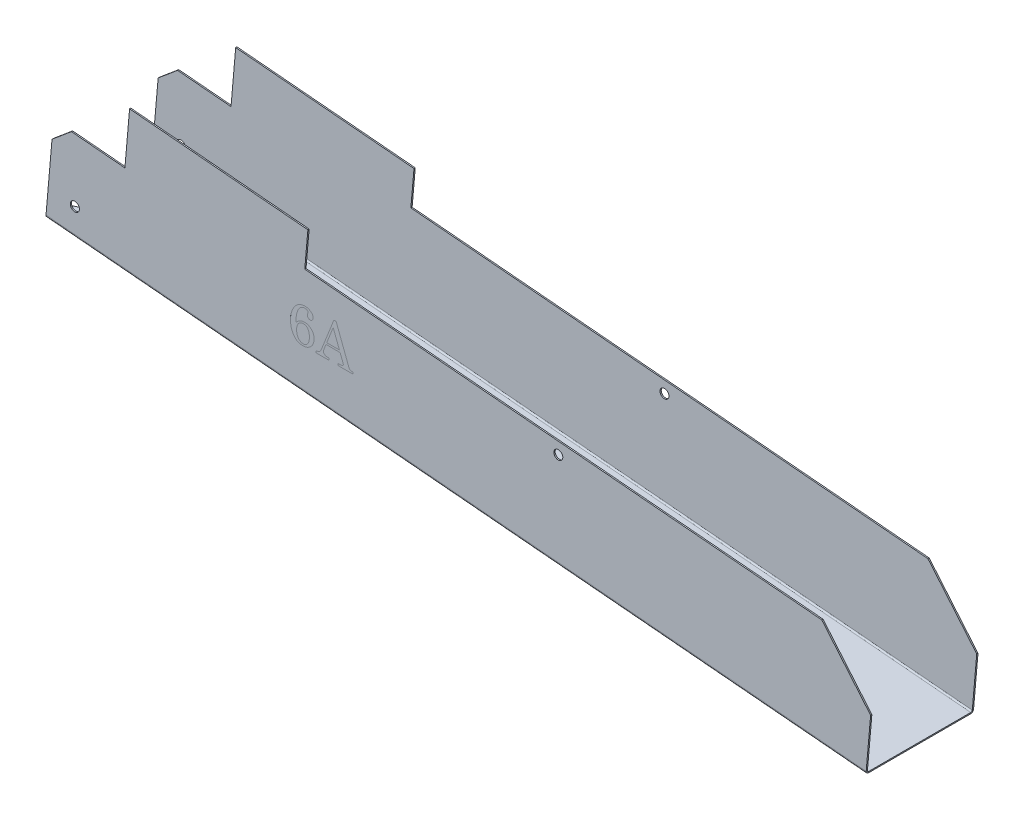
from build123d import *

# Parameters (mm, degrees)
BOSS_EXTRUDE1_DEPTH  = 38.1
CONVERT_SOLID1_START = -55.710785074
CONVERT_SOLID1_DEPTH = 584.2
CUT_EXTRUDE5_DEPTH   = 541.559685123
SKETCH7_R            = 3.2639
CUT_EXTRUDE1_DEPTH   = 542.06601882
SKETCH8_R            = 3.175
CUT_EXTRUDE2_DEPTH   = 542.06601882
CUT_EXTRUDE3_DEPTH   = 0.00254
CUT_EXTRUDE4_DEPTH   = 0.00254


# Read off the part's stored shape, not the designer's step: Convert-Solid1
with BuildPart() as part:
    # Sketch1 → Boss-Extrude1 (new, symmetric)
    with BuildSketch(Plane.XY):
        Polygon((-52.337173187, 40.992945729), (-56.764684918, -9.613744934), (525.212257707, -60.530129847), (528.532891506, -22.57511185), (493.898507307, 18.700539946), (127, 50.8), (129.213755866, 76.103345332), (2.697029208, 87.17212466), (-0.623604591, 49.217106663), (-38.578622588, 52.537740462), align=None)
    extrude(amount=BOSS_EXTRUDE1_DEPTH, both=True)

    # Convert-Solid1 outline → Convert-Solid1 (cut)
    with BuildSketch(Plane(origin=(0, 0, 0), x_dir=(0.08715574274766531, 0.9961946980917449, 0), z_dir=(0.996194698091745, -0.0871557427476653, 0)).offset(CONVERT_SOLID1_START)):
        with BuildLine():
            Line((-14.524530008, -38.1), (-12.624530008, -38.1))
            ThreePointArc((-12.624530008, -38.1), (-13.968032892, -37.543502884), (-14.524530008, -36.2))
            Line((-14.524530008, -36.2), (-14.524530008, -38.1))
        make_face()
        with BuildLine():
            Line((-14.524530008, 38.1), (-14.524530008, 36.2))
            ThreePointArc((-14.524530008, 36.2), (-13.968032892, 37.543502884), (-12.624530008, 38.1))
            Line((-12.624530008, 38.1), (-14.524530008, 38.1))
        make_face()
        with BuildLine():
            ThreePointArc((-12.624530008, 37.2), (-13.331636789, 36.907106781), (-13.624530008, 36.2))
            Line((-13.624530008, 36.2), (-13.624530008, -36.2))
            ThreePointArc((-13.624530008, -36.2), (-13.331636789, -36.907106781), (-12.624530008, -37.2))
            Line((-12.624530008, -37.2), (87.075469992, -37.2))
            Line((87.075469992, -37.2), (87.075469992, 37.2))
            Line((87.075469992, 37.2), (-12.624530008, 37.2))
        make_face()
    extrude(amount=CONVERT_SOLID1_DEPTH, mode=Mode.SUBTRACT)

    # Sketch11 → Cut-Extrude5 (cut, through all)
    with BuildSketch(Plane(origin=(-1.187456032, -13.572684558, 0), x_dir=(0.996194698091745, -0.0871557427476653, 0), z_dir=(0.0871557427476653, 0.996194698091745, 0))):
        Polygon((-55.710785074, 23.5), (-17.980790375, 0), (-55.710785074, -23.5), align=None)
    extrude(amount=-CUT_EXTRUDE5_DEPTH, mode=Mode.SUBTRACT)

    # Sketch7 → Cut-Extrude1 (cut, through all)
    with BuildSketch(Plane.XY.offset(38.1)):
        with Locations((-36.12685902, 7.703447165)):
            Circle(SKETCH7_R)
    extrude(amount=-CUT_EXTRUDE1_DEPTH, mode=Mode.SUBTRACT)

    # Sketch8 → Cut-Extrude2 (cut, through all)
    with BuildSketch(Plane.XY.offset(38.1)):
        with Locations((306.935346231, 26.643679159)):
            Circle(SKETCH8_R)
    extrude(amount=-CUT_EXTRUDE2_DEPTH, mode=Mode.SUBTRACT)

    # Sketch9 → Cut-Extrude3 (cut)
    # profile 1 of 2: a face of its own
    with BuildSketch(Plane.XY.offset(38.1)):
        with BuildLine():
            add(Edge.make_bspline(
                [(120.89433467, 15.089818668), (121.114088216, 15.345842173), (121.538987526, 15.84087041), (122.239142865, 16.478252848), (122.947738879, 17.012514754), (123.685172025, 17.424471298), (124.448056146, 17.737639932), (125.244133896, 17.954884337), (126.074937094, 18.098576279), (126.642739319, 18.111886686), (126.931063967, 18.118645585)],
                knots=[0, 0, 0, 0, 1.15518856, 2.233587714, 3.237434965, 4.189814948, 5.119660525, 6.056163246, 7.012937916, 8, 8, 8, 8], degree=3))
            add(Edge.make_bspline(
                [(126.931063967, 18.118645585), (127.163238148, 18.112284528), (127.620591221, 18.099754068), (128.29214448, 18.010660977), (128.932918228, 17.85788295), (129.545550895, 17.648311787), (130.12936233, 17.374335257), (130.684310045, 17.038368848), (131.209872932, 16.643910291), (131.699402491, 16.194529218), (132.148553243, 15.700862071), (132.540479297, 15.167432489), (132.874213134, 14.601651518), (133.146086261, 14.005552071), (133.356564242, 13.37582201), (133.508305237, 12.71563057), (133.597815675, 12.021595347), (133.610164696, 11.548600634), (133.61645395, 11.307708372)],
                knots=[0, 0, 0, 0, 1.044483906, 2.057498042, 3.041291563, 4.003930521, 4.965577941, 5.937000168, 6.91766058, 7.91718785, 8.922517361, 9.915774843, 10.889917702, 11.872928882, 12.857847881, 13.872197807, 14.916328091, 16, 16, 16, 16], degree=3))
            add(Edge.make_bspline(
                [(133.61645395, 11.307708372), (133.609686304, 11.017895276), (133.596385906, 10.448328055), (133.483616416, 9.61279963), (133.301132484, 8.813883659), (133.045838083, 8.052003737), (132.710298625, 7.331231644), (132.315625768, 6.64081832), (131.8332376, 5.995787294), (131.288239774, 5.393593114), (130.690518139, 4.847402727), (130.052725185, 4.367876698), (129.382722594, 3.955558889), (128.672045171, 3.626901354), (127.92937851, 3.36772925), (127.150897581, 3.185953045), (126.338023915, 3.073225948), (125.784071212, 3.059794099), (125.502964228, 3.052978017)],
                knots=[0, 0, 0, 0, 1.07530773, 2.113293164, 3.12278084, 4.113357206, 5.089279015, 6.06946209, 7.059700115, 8.072336363, 9.080183726, 10.060046246, 11.030156511, 11.994333323, 12.960419743, 13.944696705, 14.957022674, 16, 16, 16, 16], degree=3))
            add(Edge.make_bspline(
                [(125.502964228, 3.052978017), (125.304061517, 3.057454939), (124.908926153, 3.066348686), (124.324681697, 3.123431469), (123.756354494, 3.223199846), (123.205251831, 3.364469743), (122.672483705, 3.548125618), (122.154554857, 3.769465775), (121.655023023, 4.030885581), (121.168837033, 4.328423089), (120.708922701, 4.678109496), (120.263810831, 5.063060629), (119.840877966, 5.496050146), (119.448244789, 5.978187153), (119.066250246, 6.499042192), (118.71286809, 7.068173056), (118.38559757, 7.684367309), (118.068548348, 8.335418597), (117.790022952, 9.028342888), (117.54227243, 9.750379894), (117.338828372, 10.502308298), (117.173384272, 11.283468466), (117.035734652, 12.09094296), (116.941694516, 12.927457627), (116.89120147, 13.791866187), (116.881670292, 14.378323006), (116.876823319, 14.676559037)],
                knots=[0, 0, 0, 0, 0.883664919, 1.755467568, 2.604957291, 3.444820255, 4.280205446, 5.10616279, 5.944667041, 6.78306393, 7.635198672, 8.508239482, 9.395699299, 10.320121956, 11.268418048, 12.263647801, 13.293052967, 14.36716297, 15.479155568, 16.608498161, 17.756732724, 18.93730736, 20.154818251, 21.394408002, 22.674955442, 24, 24, 24, 24], degree=3))
            add(Edge.make_bspline(
                [(116.876823319, 14.676559037), (116.879795062, 14.999310792), (116.885682298, 15.638705063), (116.964354993, 16.58458207), (117.076561814, 17.508641461), (117.239549394, 18.409711468), (117.447659024, 19.288560268), (117.70547884, 20.14408514), (118.007541987, 20.976273219), (118.359398486, 21.779578654), (118.742311348, 22.548520564), (119.156679594, 23.273169608), (119.595775586, 23.946767655), (120.054859622, 24.575152907), (120.550070596, 25.143488446), (121.062833494, 25.672377905), (121.606648962, 26.146162918), (122.171958031, 26.573044987), (122.757389031, 26.939072232), (123.345664192, 27.267979694), (123.942631825, 27.546846434), (124.548402267, 27.771132326), (125.159184512, 27.944228183), (125.774104456, 28.072129569), (126.397429482, 28.145846084), (126.815794682, 28.156893654), (127.025224389, 28.162423964)],
                knots=[0, 0, 0, 0, 1.243152028, 2.46277293, 3.654372621, 4.828515876, 5.988718833, 7.132190138, 8.269229334, 9.397502021, 10.509151182, 11.577424797, 12.611608541, 13.605920474, 14.572893715, 15.513533556, 16.441930275, 17.348883295, 18.239769449, 19.09980024, 19.944394787, 20.775522359, 21.585751549, 22.388144142, 23.193120032, 24, 24, 24, 24], degree=3))
            add(Edge.make_bspline(
                [(127.025224389, 28.162423964), (127.238174697, 28.1591137), (127.656494255, 28.152611019), (128.27159921, 28.080233526), (128.862173988, 27.974474479), (129.427448228, 27.815460512), (129.967153936, 27.609857442), (130.484481983, 27.365642764), (130.977785124, 27.076365615), (131.281908372, 26.84888696), (131.435070833, 26.734324226)],
                knots=[0, 0, 0, 0, 1.081133678, 2.12377886, 3.141755168, 4.125997766, 5.101473931, 6.072112995, 7.02907811, 8, 8, 8, 8], degree=3))
            add(Edge.make_bspline(
                [(131.435070833, 26.734324226), (131.556118645, 26.637674953), (131.791012042, 26.450126944), (132.093665211, 26.130511832), (132.359338027, 25.806834142), (132.57721842, 25.465780445), (132.738194152, 25.104665569), (132.862683979, 24.732512785), (132.92905444, 24.342537395), (132.940903712, 24.078864435), (132.946868725, 23.946129499)],
                knots=[0, 0, 0, 0, 1.127905394, 2.18870153, 3.201176125, 4.178074235, 5.128053522, 6.076756242, 7.031824741, 8, 8, 8, 8], degree=3))
            add(Edge.make_bspline(
                [(132.946868725, 23.946129499), (132.940934165, 23.772757525), (132.929459535, 23.437538185), (132.809857183, 22.959684222), (132.622032994, 22.528966739), (132.359386265, 22.156225366), (132.041755783, 21.853445533), (131.686041661, 21.626813492), (131.291524368, 21.487637331), (131.015954788, 21.473689099), (130.875339434, 21.466571712)],
                knots=[0, 0, 0, 0, 1.153726211, 2.230760421, 3.261177434, 4.270660677, 5.249146575, 6.168386457, 7.065379467, 8, 8, 8, 8], degree=3))
            add(Edge.make_bspline(
                [(130.875339434, 21.466571712), (130.745421838, 21.473205795), (130.489441424, 21.486277121), (130.123644536, 21.602352262), (129.783907126, 21.78179695), (129.490802603, 22.041273433), (129.242868395, 22.342459386), (129.057804204, 22.680395021), (128.951365556, 23.047000786), (128.936743618, 23.300295722), (128.929357373, 23.428247176)],
                knots=[0, 0, 0, 0, 1.014689736, 1.999272662, 2.976541523, 4.002645451, 5.040935778, 6.018204639, 6.998899853, 8, 8, 8, 8], degree=3))
            add(Edge.make_bspline(
                [(128.929357373, 23.428247176), (128.937531178, 23.61911687), (128.954945449, 24.025764249), (129.051010302, 24.421448019), (129.101984814, 24.631408128)],
                knots=[0, 0, 0, 0, 0.938747937, 2, 2, 2, 2], degree=3))
            add(Edge.make_bspline(
                [(129.101984814, 24.631408128), (129.128139219, 24.728686237), (129.177312618, 24.91158068), (129.220288065, 25.173132084), (129.257050947, 25.399394124), (129.261911749, 25.539763682), (129.264149986, 25.604399158)],
                knots=[0, 0, 0, 0, 1.221676289, 2.296897074, 3.215778188, 4, 4, 4, 4], degree=3))
            add(Edge.make_bspline(
                [(129.264149986, 25.604399158), (129.260239071, 25.683868784), (129.252494311, 25.841241978), (129.155915195, 26.059883442), (129.008694851, 26.258592567), (128.874930162, 26.360854425), (128.803810143, 26.415225017)],
                knots=[0, 0, 0, 0, 0.975009045, 1.930804205, 2.899849836, 4, 4, 4, 4], degree=3))
            add(Edge.make_bspline(
                [(128.803810143, 26.415225017), (128.694040529, 26.478382471), (128.464525254, 26.610437235), (128.063622259, 26.738987531), (127.606622277, 26.808198673), (127.283547461, 26.81807512), (127.114153677, 26.823253514)],
                knots=[0, 0, 0, 0, 0.860759205, 1.799745656, 2.846368109, 4, 4, 4, 4], degree=3))
            add(Edge.make_bspline(
                [(127.114153677, 26.823253514), (126.842478379, 26.812682502), (126.305474194, 26.791787421), (125.52393702, 26.578232915), (124.775576183, 26.253866271), (124.195066778, 25.866797314), (123.750323222, 25.495986708), (123.429501375, 25.161431408), (123.123489829, 24.780346822), (122.829315951, 24.35297439), (122.547689992, 23.88055804), (122.273808486, 23.361640789), (122.021011662, 22.792264893), (121.697322407, 21.96867417), (121.348902277, 20.869822693), (121.054298255, 19.475479799), (120.871628266, 18.001446734), (120.852051293, 16.9927546), (120.842023324, 16.47606933)],
                knots=[0, 0, 0, 0, 0.971688549, 1.920678183, 2.88340009, 3.885392209, 4.408774106, 4.956875509, 5.543534456, 6.159017994, 6.815026857, 7.513966368, 8.260917618, 9.046686804, 10.685410247, 12.385720898, 14.148647427, 16, 16, 16, 16], degree=3))
            add(Edge.make_bspline(
                [(120.842023324, 16.47606933), (120.843519451, 16.388877473), (120.846811567, 16.197018209), (120.858210949, 15.879669817), (120.873722498, 15.50475786), (120.887145755, 15.234537162), (120.89433467, 15.089818668)],
                knots=[0, 0, 0, 0, 0.754292582, 1.659765325, 2.74667174, 4, 4, 4, 4], degree=3))
        make_face()
        with BuildLine():
            add(Edge.make_bspline(
                [(126.026077686, 16.779475135), (125.854902559, 16.774308519), (125.517943655, 16.764138016), (125.023958287, 16.687928154), (124.551939118, 16.571718788), (124.10565542, 16.39362446), (123.683148695, 16.171247458), (123.287322107, 15.893874221), (122.912819959, 15.572690993), (122.565004715, 15.203346794), (122.248748804, 14.789144223), (121.979085552, 14.330231455), (121.739319201, 13.837515065), (121.553371588, 13.299321711), (121.407532431, 12.723409035), (121.303834923, 12.107643488), (121.240246332, 11.452037247), (121.232904463, 11.000965095), (121.229127283, 10.768901511)],
                knots=[0, 0, 0, 0, 0.949075543, 1.868258902, 2.766701683, 3.639584075, 4.526552555, 5.40923933, 6.314579547, 7.258763553, 8.218230028, 9.198529645, 10.206493817, 11.252665883, 12.350497027, 13.498519192, 14.713060431, 16, 16, 16, 16], degree=3))
            add(Edge.make_bspline(
                [(121.229127283, 10.768901511), (121.232749537, 10.517649445), (121.239779729, 10.030011014), (121.30516682, 9.322720062), (121.401798309, 8.65971962), (121.542090852, 8.041833853), (121.724073329, 7.46865906), (121.949920046, 6.943837268), (122.212280471, 6.462369512), (122.514301665, 6.029169454), (122.851721578, 5.645596454), (123.211928673, 5.309606024), (123.595871941, 5.0245511), (124.001398316, 4.792589912), (124.429621987, 4.611551014), (124.882162154, 4.4890596), (125.355218696, 4.406111839), (125.678716257, 4.396851074), (125.842987976, 4.392148468)],
                knots=[0, 0, 0, 0, 1.364103527, 2.647497837, 3.854117083, 5.000370457, 6.084428247, 7.115189779, 8.098401111, 9.057233799, 9.976535432, 10.867705672, 11.727535847, 12.567318146, 13.399161598, 14.244637041, 15.108628548, 16, 16, 16, 16], degree=3))
            add(Edge.make_bspline(
                [(125.842987976, 4.392148468), (126.00544655, 4.397281487), (126.323338108, 4.407325545), (126.788167355, 4.483037976), (127.228797586, 4.60256894), (127.646930508, 4.769611707), (128.036143754, 4.993838658), (128.404089562, 5.260661072), (128.745622388, 5.57744355), (129.061438817, 5.941976285), (129.349842295, 6.353393312), (129.594855368, 6.818786296), (129.803798756, 7.328787751), (129.977021702, 7.885022026), (130.105756984, 8.49123243), (130.197838849, 9.143227635), (130.256553463, 9.843677169), (130.264445025, 10.325877272), (130.268527824, 10.575349532)],
                knots=[0, 0, 0, 0, 0.909396033, 1.779464838, 2.629860702, 3.462124791, 4.29295567, 5.138629575, 6.002374521, 6.895212095, 7.835129073, 8.809266767, 9.833779316, 10.917798107, 12.066925648, 13.300059089, 14.603151772, 16, 16, 16, 16], degree=3))
            add(Edge.make_bspline(
                [(130.268527824, 10.575349532), (130.266169319, 10.83874703), (130.261618983, 11.346928015), (130.208509273, 12.082189126), (130.122185612, 12.762214572), (129.997104982, 13.384344116), (129.841473688, 13.950482474), (129.6480721, 14.46066289), (129.420861428, 14.916567413), (129.154404219, 15.314890708), (128.860622905, 15.663644687), (128.534544894, 15.963092807), (128.182647247, 16.215046988), (127.803990565, 16.423842221), (127.397611977, 16.584022361), (126.964235824, 16.699784395), (126.504393924, 16.769561835), (126.188494273, 16.776108985), (126.026077686, 16.779475135)],
                knots=[0, 0, 0, 0, 1.481997958, 2.859264748, 4.145766163, 5.336979382, 6.427417082, 7.446135251, 8.402802757, 9.287300334, 10.136644771, 10.963063103, 11.771815852, 12.566698608, 13.39031591, 14.223406735, 15.086582672, 16, 16, 16, 16], degree=3))
        make_face(mode=Mode.SUBTRACT)
    # profile 2 of 2: a face of its own
    with BuildSketch(Plane.XY.offset(38.1)):
        with BuildLine():
            Line((147.667281411, 29.836387027), (149.252315186, 29.836387027))
            Line((149.252315186, 29.836387027), (158.281253458, 6.191658761))
            add(Edge.make_bspline(
                [(158.281253458, 6.191658761), (158.331763824, 6.074710298), (158.428767939, 5.850113185), (158.629710333, 5.549230252), (158.862347869, 5.289883042), (159.141675612, 5.086518511), (159.448382854, 4.916329442), (159.80059728, 4.8143571), (160.183515277, 4.734026653), (160.453420453, 4.729361041), (160.593414939, 4.72694108)],
                knots=[0, 0, 0, 0, 1.039787226, 1.996889935, 2.945563617, 3.872445737, 4.810232727, 5.797866669, 6.857796924, 8, 8, 8, 8], degree=3))
            Line((160.593414939, 4.72694108), (161.404240798, 4.72694108))
            Line((161.404240798, 4.72694108), (161.404240798, 3.38777063))
            Line((161.404240798, 3.38777063), (150.690877194, 3.38777063))
            Line((150.690877194, 3.38777063), (150.690877194, 4.72694108))
            Line((150.690877194, 4.72694108), (151.543552129, 4.72694108))
            add(Edge.make_bspline(
                [(151.543552129, 4.72694108), (151.801931058, 4.729449204), (152.279632334, 4.734086322), (152.932993426, 4.803538), (153.472887149, 4.898148272), (153.773491061, 5.025612295), (153.908024956, 5.082658231)],
                knots=[0, 0, 0, 0, 1.28614417, 2.377874675, 3.274025287, 4, 4, 4, 4], degree=3))
            add(Edge.make_bspline(
                [(153.908024956, 5.082658231), (153.978625849, 5.126311345), (154.115739961, 5.211090129), (154.27386224, 5.392429707), (154.360013044, 5.614663137), (154.372403013, 5.770720891), (154.378827067, 5.851635013)],
                knots=[0, 0, 0, 0, 1.044845995, 2.029197152, 2.978161746, 4, 4, 4, 4], degree=3))
            add(Edge.make_bspline(
                [(154.378827067, 5.851635013), (154.373122039, 5.957203687), (154.361191286, 6.177976232), (154.286844472, 6.386337281), (154.248048703, 6.495064566)],
                knots=[0, 0, 0, 0, 0.9563569, 2, 2, 2, 2], degree=3))
            Line((154.248048703, 6.495064566), (152.108514663, 12.092378558))
            Line((152.108514663, 12.092378558), (142.080429688, 12.092378558))
            Line((142.080429688, 12.092378558), (140.814495121, 8.880461931))
            add(Edge.make_bspline(
                [(140.814495121, 8.880461931), (140.743916929, 8.678988642), (140.611781776, 8.301794174), (140.464251816, 7.760425611), (140.367329394, 7.284876553), (140.351118004, 6.987145699), (140.34369301, 6.850781717)],
                knots=[0, 0, 0, 0, 1.224040328, 2.291625076, 3.217545626, 4, 4, 4, 4], degree=3))
            add(Edge.make_bspline(
                [(140.34369301, 6.850781717), (140.354056748, 6.708230254), (140.374467429, 6.427484811), (140.530897566, 6.023157524), (140.791170979, 5.660290872), (141.138973477, 5.325895431), (141.589660711, 5.05327409), (142.13479711, 4.864434332), (142.76546428, 4.741116618), (143.216667112, 4.731857107), (143.45621808, 4.72694108)],
                knots=[0, 0, 0, 0, 0.81354721, 1.602226087, 2.440081589, 3.349586742, 4.342853265, 5.424428202, 6.632586778, 8, 8, 8, 8], degree=3))
            Line((143.45621808, 4.72694108), (144.329817554, 4.72694108))
            Line((144.329817554, 4.72694108), (144.329817554, 3.38777063))
            Line((144.329817554, 3.38777063), (134.9556244, 3.38777063))
            Line((134.9556244, 3.38777063), (134.9556244, 4.72694108))
            add(Edge.make_bspline(
                [(134.9556244, 4.72694108), (135.198613629, 4.734080283), (135.662028285, 4.747695748), (136.318459585, 4.874072376), (136.897708662, 5.080370234), (137.409285025, 5.385972702), (137.866980605, 5.81655579), (138.276144723, 6.394067359), (138.684889284, 7.106684976), (138.909831112, 7.648028061), (139.030678232, 7.938857708)],
                knots=[0, 0, 0, 0, 1.036060294, 1.975912788, 2.839911673, 3.647735987, 4.500737518, 5.500873586, 6.657376306, 8, 8, 8, 8], degree=3))
            Line((139.030678232, 7.938857708), (147.667281411, 29.836387027))
        make_face()
        Polygon((147.175554761, 25.013280952), (142.60877428, 13.431549009), (151.595863475, 13.431549009), align=None, mode=Mode.SUBTRACT)
    extrude(amount=-CUT_EXTRUDE3_DEPTH, mode=Mode.SUBTRACT)

    # Sketch10 → Cut-Extrude4 (cut)
    # profile 1 of 2: a face of its own
    with BuildSketch(Plane(origin=(0, 0, -38.1), x_dir=(-1, 0, 0), z_dir=(0, 0, -1))):
        with BuildLine():
            add(Edge.make_bspline(
                [(-155.278783024, 13.635392643), (-155.059029478, 13.891416148), (-154.634130169, 14.386444385), (-153.93397483, 15.023826823), (-153.225378815, 15.558088729), (-152.48794567, 15.970045273), (-151.725061548, 16.283213907), (-150.928983798, 16.500458312), (-150.098180601, 16.644150254), (-149.530378376, 16.65746066), (-149.242053728, 16.66421956)],
                knots=[0, 0, 0, 0, 1.15518856, 2.233587714, 3.237434965, 4.189814948, 5.119660525, 6.056163246, 7.012937916, 8, 8, 8, 8], degree=3))
            add(Edge.make_bspline(
                [(-149.242053728, 16.66421956), (-149.009879546, 16.657858503), (-148.552526473, 16.645328043), (-147.880973214, 16.556234952), (-147.240199466, 16.403456924), (-146.6275668, 16.193885761), (-146.043755365, 15.919909232), (-145.488807649, 15.583942823), (-144.963244762, 15.189484266), (-144.473715204, 14.740103193), (-144.024564452, 14.246436046), (-143.632638397, 13.713006464), (-143.298904561, 13.147225493), (-143.027031434, 12.551126046), (-142.816553452, 11.921395985), (-142.664812457, 11.261204545), (-142.57530202, 10.567169322), (-142.562952998, 10.094174609), (-142.556663745, 9.853282347)],
                knots=[0, 0, 0, 0, 1.044483906, 2.057498042, 3.041291563, 4.003930521, 4.965577941, 5.937000168, 6.91766058, 7.91718785, 8.922517361, 9.915774843, 10.889917702, 11.872928882, 12.857847881, 13.872197807, 14.916328091, 16, 16, 16, 16], degree=3))
            add(Edge.make_bspline(
                [(-142.556663745, 9.853282347), (-142.563431391, 9.56346925), (-142.576731788, 8.993902029), (-142.689501278, 8.158373604), (-142.871985211, 7.359457634), (-143.127279612, 6.597577711), (-143.462819069, 5.876805619), (-143.857491927, 5.186392295), (-144.339880094, 4.541361269), (-144.88487792, 3.939167089), (-145.482599555, 3.392976702), (-146.120392509, 2.913450672), (-146.7903951, 2.501132864), (-147.501072524, 2.172475329), (-148.243739185, 1.913303225), (-149.022220113, 1.73152702), (-149.83509378, 1.618799923), (-150.389046483, 1.605368073), (-150.670153466, 1.598551992)],
                knots=[0, 0, 0, 0, 1.07530773, 2.113293164, 3.12278084, 4.113357206, 5.089279015, 6.06946209, 7.059700115, 8.072336363, 9.080183726, 10.060046246, 11.030156511, 11.994333323, 12.960419743, 13.944696705, 14.957022674, 16, 16, 16, 16], degree=3))
            add(Edge.make_bspline(
                [(-150.670153466, 1.598551992), (-150.869056178, 1.603028914), (-151.264191542, 1.611922661), (-151.848435998, 1.669005444), (-152.4167632, 1.768773821), (-152.967865863, 1.910043718), (-153.500633989, 2.093699592), (-154.018562837, 2.31503975), (-154.518094671, 2.576459556), (-155.004280661, 2.873997064), (-155.464194993, 3.22368347), (-155.909306863, 3.608634603), (-156.332239729, 4.04162412), (-156.724872905, 4.523761127), (-157.106867449, 5.044616167), (-157.460249604, 5.61374703), (-157.787520124, 6.229941283), (-158.104569346, 6.880992571), (-158.383094742, 7.573916863), (-158.630845265, 8.295953868), (-158.834289322, 9.047882273), (-158.999733422, 9.82904244), (-159.137383043, 10.636516935), (-159.231423178, 11.473031601), (-159.281916224, 12.337440161), (-159.291447402, 12.92389698), (-159.296294376, 13.222133011)],
                knots=[0, 0, 0, 0, 0.883664919, 1.755467568, 2.604957291, 3.444820255, 4.280205446, 5.10616279, 5.944667041, 6.78306393, 7.635198672, 8.508239482, 9.395699299, 10.320121956, 11.268418048, 12.263647801, 13.293052967, 14.36716297, 15.479155568, 16.608498161, 17.756732724, 18.93730736, 20.154818251, 21.394408002, 22.674955442, 24, 24, 24, 24], degree=3))
            add(Edge.make_bspline(
                [(-159.296294376, 13.222133011), (-159.293322632, 13.544884766), (-159.287435396, 14.184279038), (-159.208762701, 15.130156045), (-159.09655588, 16.054215436), (-158.9335683, 16.955285443), (-158.72545867, 17.834134243), (-158.467638855, 18.689659115), (-158.165575708, 19.521847194), (-157.813719208, 20.325152629), (-157.430806346, 21.094094538), (-157.0164381, 21.818743583), (-156.577342109, 22.492341629), (-156.118258073, 23.120726881), (-155.623047099, 23.689062421), (-155.1102842, 24.21795188), (-154.566468733, 24.691736893), (-154.001159663, 25.118618962), (-153.415728663, 25.484646207), (-152.827453502, 25.813553669), (-152.230485869, 26.092420408), (-151.624715428, 26.316706301), (-151.013933183, 26.489802158), (-150.399013239, 26.617703544), (-149.775688212, 26.691420059), (-149.357323012, 26.702467629), (-149.147893306, 26.707997939)],
                knots=[0, 0, 0, 0, 1.243152028, 2.46277293, 3.654372621, 4.828515876, 5.988718833, 7.132190138, 8.269229334, 9.397502021, 10.509151182, 11.577424797, 12.611608541, 13.605920474, 14.572893715, 15.513533556, 16.441930275, 17.348883295, 18.239769449, 19.09980024, 19.944394787, 20.775522359, 21.585751549, 22.388144142, 23.193120032, 24, 24, 24, 24], degree=3))
            add(Edge.make_bspline(
                [(-149.147893306, 26.707997939), (-148.934942998, 26.704687675), (-148.51662344, 26.698184993), (-147.901518484, 26.6258075), (-147.310943706, 26.520048454), (-146.745669466, 26.361034486), (-146.205963759, 26.155431417), (-145.688635712, 25.911216738), (-145.19533257, 25.62193959), (-144.891209322, 25.394460935), (-144.738046861, 25.279898201)],
                knots=[0, 0, 0, 0, 1.081133678, 2.12377886, 3.141755168, 4.125997766, 5.101473931, 6.072112995, 7.02907811, 8, 8, 8, 8], degree=3))
            add(Edge.make_bspline(
                [(-144.738046861, 25.279898201), (-144.61699905, 25.183248928), (-144.382105652, 24.995700919), (-144.079452483, 24.676085806), (-143.813779668, 24.352408117), (-143.595899275, 24.01135442), (-143.434923543, 23.650239543), (-143.310433715, 23.27808676), (-143.244063255, 22.88811137), (-143.232213982, 22.624438409), (-143.22624897, 22.491703474)],
                knots=[0, 0, 0, 0, 1.127905394, 2.18870153, 3.201176125, 4.178074235, 5.128053522, 6.076756242, 7.031824741, 8, 8, 8, 8], degree=3))
            add(Edge.make_bspline(
                [(-143.22624897, 22.491703474), (-143.23218353, 22.318331499), (-143.24365816, 21.98311216), (-143.363260511, 21.505258197), (-143.551084701, 21.074540714), (-143.813731429, 20.701799341), (-144.131361911, 20.399019507), (-144.487076034, 20.172387466), (-144.881593327, 20.033211306), (-145.157162906, 20.019263074), (-145.29777826, 20.012145686)],
                knots=[0, 0, 0, 0, 1.153726211, 2.230760421, 3.261177434, 4.270660677, 5.249146575, 6.168386457, 7.065379467, 8, 8, 8, 8], degree=3))
            add(Edge.make_bspline(
                [(-145.29777826, 20.012145686), (-145.427695857, 20.018779769), (-145.683676271, 20.031851096), (-146.049473158, 20.147926237), (-146.389210569, 20.327370925), (-146.682315092, 20.586847408), (-146.930249299, 20.88803336), (-147.11531349, 21.225968995), (-147.221752138, 21.592574761), (-147.236374077, 21.845869697), (-147.243760321, 21.973821151)],
                knots=[0, 0, 0, 0, 1.014689736, 1.999272662, 2.976541523, 4.002645451, 5.040935778, 6.018204639, 6.998899853, 8, 8, 8, 8], degree=3))
            add(Edge.make_bspline(
                [(-147.243760321, 21.973821151), (-147.235586516, 22.164690845), (-147.218172246, 22.571338224), (-147.122107392, 22.967021994), (-147.07113288, 23.176982103)],
                knots=[0, 0, 0, 0, 0.938747937, 2, 2, 2, 2], degree=3))
            add(Edge.make_bspline(
                [(-147.07113288, 23.176982103), (-147.044978476, 23.274260212), (-146.995805077, 23.457154654), (-146.95282963, 23.718706059), (-146.916066747, 23.944968099), (-146.911205945, 24.085337657), (-146.908967709, 24.149973133)],
                knots=[0, 0, 0, 0, 1.221676289, 2.296897074, 3.215778188, 4, 4, 4, 4], degree=3))
            add(Edge.make_bspline(
                [(-146.908967709, 24.149973133), (-146.912878624, 24.229442759), (-146.920623384, 24.386815952), (-147.017202499, 24.605457417), (-147.164422843, 24.804166542), (-147.298187532, 24.9064284), (-147.369307551, 24.960798992)],
                knots=[0, 0, 0, 0, 0.975009045, 1.930804205, 2.899849836, 4, 4, 4, 4], degree=3))
            add(Edge.make_bspline(
                [(-147.369307551, 24.960798992), (-147.479077165, 25.023956446), (-147.708592441, 25.15601121), (-148.109495435, 25.284561505), (-148.566495418, 25.353772648), (-148.889570233, 25.363649094), (-149.058964018, 25.368827488)],
                knots=[0, 0, 0, 0, 0.860759205, 1.799745656, 2.846368109, 4, 4, 4, 4], degree=3))
            add(Edge.make_bspline(
                [(-149.058964018, 25.368827488), (-149.330639315, 25.358256477), (-149.8676435, 25.337361396), (-150.649180674, 25.12380689), (-151.397541511, 24.799440246), (-151.978050917, 24.412371289), (-152.422794473, 24.041560683), (-152.743616319, 23.707005383), (-153.049627865, 23.325920796), (-153.343801743, 22.898548364), (-153.625427702, 22.426132014), (-153.899309208, 21.907214764), (-154.152106032, 21.337838867), (-154.475795287, 20.514248145), (-154.824215417, 19.415396667), (-155.11881944, 18.021053774), (-155.301489429, 16.547020709), (-155.321066401, 15.538328575), (-155.33109437, 15.021643304)],
                knots=[0, 0, 0, 0, 0.971688549, 1.920678183, 2.88340009, 3.885392209, 4.408774106, 4.956875509, 5.543534456, 6.159017994, 6.815026857, 7.513966368, 8.260917618, 9.046686804, 10.685410247, 12.385720898, 14.148647427, 16, 16, 16, 16], degree=3))
            add(Edge.make_bspline(
                [(-155.33109437, 15.021643304), (-155.329598244, 14.934451448), (-155.326306128, 14.742592183), (-155.314906745, 14.425243792), (-155.299395197, 14.050331835), (-155.285971939, 13.780111137), (-155.278783024, 13.635392643)],
                knots=[0, 0, 0, 0, 0.754292582, 1.659765325, 2.74667174, 4, 4, 4, 4], degree=3))
        make_face()
        with BuildLine():
            add(Edge.make_bspline(
                [(-150.147040009, 15.32504911), (-150.318215136, 15.319882494), (-150.655174039, 15.309711991), (-151.149159407, 15.233502129), (-151.621178576, 15.117292763), (-152.067462274, 14.939198435), (-152.489969, 14.716821433), (-152.885795588, 14.439448196), (-153.260297735, 14.118264968), (-153.608112979, 13.748920768), (-153.924368891, 13.334718198), (-154.194032143, 12.87580543), (-154.433798494, 12.38308904), (-154.619746107, 11.844895685), (-154.765585263, 11.268983009), (-154.869282771, 10.653217463), (-154.932871362, 9.997611222), (-154.940213232, 9.54653907), (-154.943990412, 9.314475486)],
                knots=[0, 0, 0, 0, 0.949075543, 1.868258902, 2.766701683, 3.639584075, 4.526552555, 5.40923933, 6.314579547, 7.258763553, 8.218230028, 9.198529645, 10.206493817, 11.252665883, 12.350497027, 13.498519192, 14.713060431, 16, 16, 16, 16], degree=3))
            add(Edge.make_bspline(
                [(-154.943990412, 9.314475486), (-154.940368157, 9.063223419), (-154.933337965, 8.575584989), (-154.867950875, 7.868294037), (-154.771319385, 7.205293595), (-154.631026842, 6.587407827), (-154.449044365, 6.014233035), (-154.223197648, 5.489411243), (-153.960837223, 5.007943487), (-153.658816029, 4.574743429), (-153.321396116, 4.191170428), (-152.961189022, 3.855179998), (-152.577245753, 3.570125075), (-152.171719379, 3.338163887), (-151.743495708, 3.157124989), (-151.29095554, 3.034633575), (-150.817898998, 2.951685814), (-150.494401438, 2.942425049), (-150.330129719, 2.937722442)],
                knots=[0, 0, 0, 0, 1.364103527, 2.647497837, 3.854117083, 5.000370457, 6.084428247, 7.115189779, 8.098401111, 9.057233799, 9.976535432, 10.867705672, 11.727535847, 12.567318146, 13.399161598, 14.244637041, 15.108628548, 16, 16, 16, 16], degree=3))
            add(Edge.make_bspline(
                [(-150.330129719, 2.937722442), (-150.167671144, 2.942855461), (-149.849779587, 2.952899519), (-149.384950339, 3.028611951), (-148.944320108, 3.148142914), (-148.526187186, 3.315185682), (-148.13697394, 3.539412632), (-147.769028133, 3.806235047), (-147.427495307, 4.123017525), (-147.111678878, 4.48755026), (-146.823275399, 4.898967287), (-146.578262326, 5.364360271), (-146.369318938, 5.874361725), (-146.196095992, 6.430596001), (-146.067360711, 7.036806405), (-145.975278845, 7.68880161), (-145.916564232, 8.389251143), (-145.908672669, 8.871451247), (-145.904589871, 9.120923507)],
                knots=[0, 0, 0, 0, 0.909396033, 1.779464838, 2.629860702, 3.462124791, 4.29295567, 5.138629575, 6.002374521, 6.895212095, 7.835129073, 8.809266767, 9.833779316, 10.917798107, 12.066925648, 13.300059089, 14.603151772, 16, 16, 16, 16], degree=3))
            add(Edge.make_bspline(
                [(-145.904589871, 9.120923507), (-145.906948375, 9.384321005), (-145.911498712, 9.892501989), (-145.964608421, 10.6277631), (-146.050932082, 11.307788547), (-146.176012713, 11.929918091), (-146.331644006, 12.496056449), (-146.525045594, 13.006236864), (-146.752256267, 13.462141388), (-147.018713476, 13.860464682), (-147.312494789, 14.209218662), (-147.638572801, 14.508666782), (-147.990470448, 14.760620963), (-148.36912713, 14.969416196), (-148.775505717, 15.129596336), (-149.20888187, 15.24535837), (-149.668723771, 15.31513581), (-149.984623422, 15.321682959), (-150.147040009, 15.32504911)],
                knots=[0, 0, 0, 0, 1.481997958, 2.859264748, 4.145766163, 5.336979382, 6.427417082, 7.446135251, 8.402802757, 9.287300334, 10.136644771, 10.963063103, 11.771815852, 12.566698608, 13.39031591, 14.223406735, 15.086582672, 16, 16, 16, 16], degree=3))
        make_face(mode=Mode.SUBTRACT)
    # profile 2 of 2: a face of its own
    with BuildSketch(Plane(origin=(0, 0, -38.1), x_dir=(-1, 0, 0), z_dir=(0, 0, -1))):
        with BuildLine():
            Line((-128.505836283, 28.381961002), (-126.920802508, 28.381961002))
            Line((-126.920802508, 28.381961002), (-117.891864236, 4.737232735))
            add(Edge.make_bspline(
                [(-117.891864236, 4.737232735), (-117.841353871, 4.620284272), (-117.744349755, 4.39568716), (-117.543407361, 4.094804227), (-117.310769825, 3.835457016), (-117.031442082, 3.632092486), (-116.72473484, 3.461903416), (-116.372520414, 3.359931075), (-115.989602418, 3.279600627), (-115.719697241, 3.274935016), (-115.579702755, 3.272515055)],
                knots=[0, 0, 0, 0, 1.039787226, 1.996889935, 2.945563617, 3.872445737, 4.810232727, 5.797866669, 6.857796924, 8, 8, 8, 8], degree=3))
            Line((-115.579702755, 3.272515055), (-114.768876897, 3.272515055))
            Line((-114.768876897, 3.272515055), (-114.768876897, 1.933344605))
            Line((-114.768876897, 1.933344605), (-125.482240501, 1.933344605))
            Line((-125.482240501, 1.933344605), (-125.482240501, 3.272515055))
            Line((-125.482240501, 3.272515055), (-124.629565565, 3.272515055))
            add(Edge.make_bspline(
                [(-124.629565565, 3.272515055), (-124.371186637, 3.275023178), (-123.89348536, 3.279660297), (-123.240124268, 3.349111975), (-122.700230545, 3.443722247), (-122.399626634, 3.57118627), (-122.265092739, 3.628232206)],
                knots=[0, 0, 0, 0, 1.28614417, 2.377874675, 3.274025287, 4, 4, 4, 4], degree=3))
            add(Edge.make_bspline(
                [(-122.265092739, 3.628232206), (-122.194491846, 3.671885319), (-122.057377734, 3.756664104), (-121.899255454, 3.938003682), (-121.81310465, 4.160237112), (-121.800714681, 4.316294866), (-121.794290627, 4.397208988)],
                knots=[0, 0, 0, 0, 1.044845995, 2.029197152, 2.978161746, 4, 4, 4, 4], degree=3))
            add(Edge.make_bspline(
                [(-121.794290627, 4.397208988), (-121.799995656, 4.502777662), (-121.811926408, 4.723550207), (-121.886273222, 4.931911255), (-121.925068992, 5.04063854)],
                knots=[0, 0, 0, 0, 0.9563569, 2, 2, 2, 2], degree=3))
            Line((-121.925068992, 5.04063854), (-124.064603032, 10.637952533))
            Line((-124.064603032, 10.637952533), (-134.092688007, 10.637952533))
            Line((-134.092688007, 10.637952533), (-135.358622573, 7.426035905))
            add(Edge.make_bspline(
                [(-135.358622573, 7.426035905), (-135.429200766, 7.224562617), (-135.561335918, 6.847368149), (-135.708865878, 6.305999585), (-135.8057883, 5.830450527), (-135.821999691, 5.532719674), (-135.829424685, 5.396355691)],
                knots=[0, 0, 0, 0, 1.224040328, 2.291625076, 3.217545626, 4, 4, 4, 4], degree=3))
            add(Edge.make_bspline(
                [(-135.829424685, 5.396355691), (-135.819060946, 5.253804229), (-135.798650266, 4.973058786), (-135.642220129, 4.568731499), (-135.381946715, 4.205864846), (-135.034144217, 3.871469405), (-134.583456983, 3.598848065), (-134.038320585, 3.410008307), (-133.407653414, 3.286690593), (-132.956450583, 3.277431081), (-132.716899614, 3.272515055)],
                knots=[0, 0, 0, 0, 0.81354721, 1.602226087, 2.440081589, 3.349586742, 4.342853265, 5.424428202, 6.632586778, 8, 8, 8, 8], degree=3))
            Line((-132.716899614, 3.272515055), (-131.843300141, 3.272515055))
            Line((-131.843300141, 3.272515055), (-131.843300141, 1.933344605))
            Line((-131.843300141, 1.933344605), (-141.217493294, 1.933344605))
            Line((-141.217493294, 1.933344605), (-141.217493294, 3.272515055))
            add(Edge.make_bspline(
                [(-141.217493294, 3.272515055), (-140.974504065, 3.279654258), (-140.51108941, 3.293269723), (-139.854658109, 3.419646351), (-139.275409033, 3.625944209), (-138.763832669, 3.931546677), (-138.306137089, 4.362129765), (-137.896972972, 4.939641333), (-137.488228411, 5.652258951), (-137.263286582, 6.193602036), (-137.142439462, 6.484431682)],
                knots=[0, 0, 0, 0, 1.036060294, 1.975912788, 2.839911673, 3.647735987, 4.500737518, 5.500873586, 6.657376306, 8, 8, 8, 8], degree=3))
            Line((-137.142439462, 6.484431682), (-128.505836283, 28.381961002))
        make_face()
        Polygon((-128.997562933, 23.558854926), (-133.564343415, 11.977122983), (-124.57725422, 11.977122983), align=None, mode=Mode.SUBTRACT)
    extrude(amount=-CUT_EXTRUDE4_DEPTH, mode=Mode.SUBTRACT)


solid = part.part
